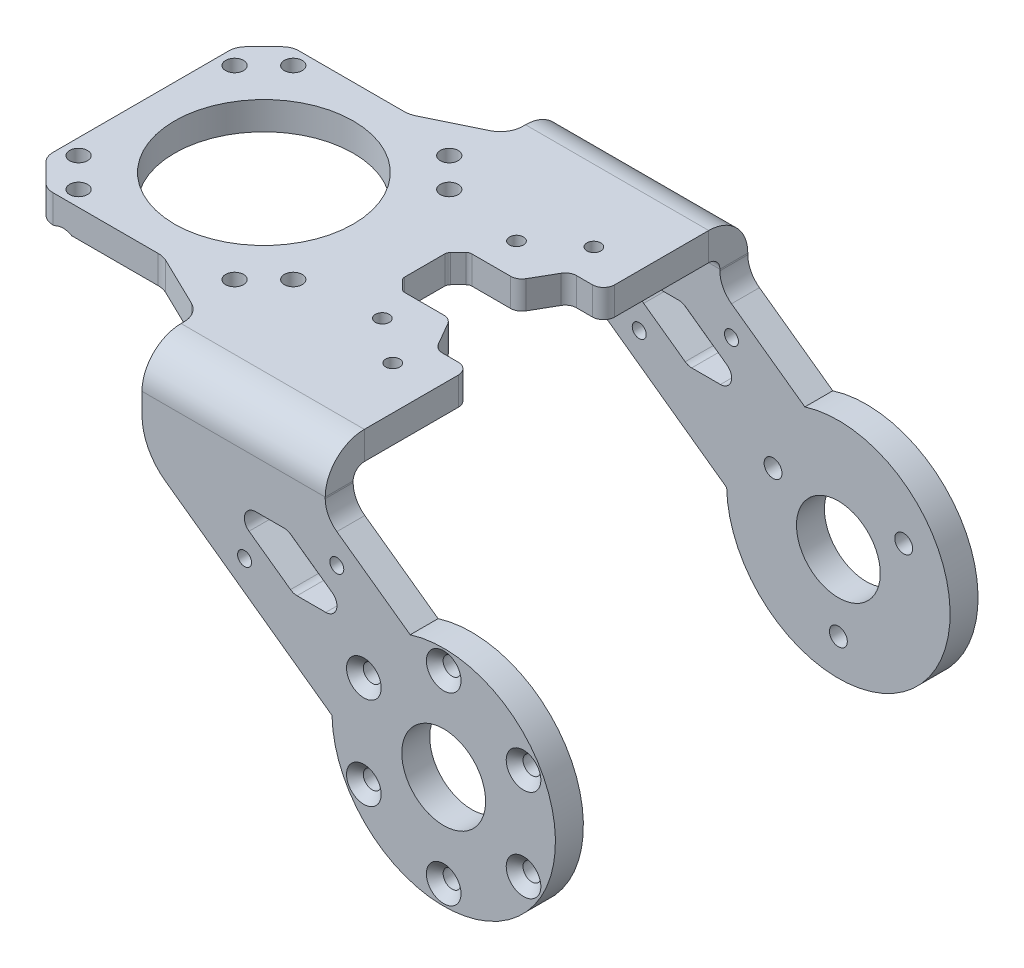
from build123d import *

# Parameters (mm, degrees)
SKETCH_1_R                     = 1.6
SKETCH_1_R_2                   = 16
SKETCH_1_R_3                   = 7.5
SM_BASE_FLANGE_1_DEPTH         = 5
OTHER_START                    = 37.819137438
OTHER_5_OUTLINE_W              = 32.792856849
OTHER_5_OUTLINE_H              = 5
OTHER_5_DEPTH                  = 38.830862462
OTHER_START_2                  = 32.819137438
OTHER_5_2_OUTLINE_R            = 1.6
OTHER_5_2_OUTLINE_R_2          = 7.5
OTHER_5_2_DEPTH                = 4.31918
OTHER_START_3                  = 30.819137438
OTHER_5_3_OUTLINE_R            = 1.6
OTHER_5_3_OUTLINE_R_2          = 7.5
OTHER_5_3_DEPTH                = 7
OTHER_START_4                  = 16
OTHER_5_4_DEPTH                = 75
OTHER_START_5                  = -77.5000001
OTHER_6_OUTLINE_W              = 32.792856849
OTHER_6_OUTLINE_H              = 5
OTHER_6_DEPTH                  = 39.680862662
OTHER_START_6                  = -37.138317438
OTHER_6_2_OUTLINE_R            = 1.6
OTHER_6_2_OUTLINE_R_2          = 7.5
OTHER_6_2_DEPTH                = 4.31918
OTHER_START_7                  = -37.819137438
OTHER_6_3_OUTLINE_R            = 1.6
OTHER_6_3_OUTLINE_R_2          = 7.5
OTHER_6_3_DEPTH                = 7
OTHER_6_4_DEPTH                = 75
CHAMFER_1_SIZE                 = 5
FILLET_1_R                     = 3
CUT_EXTRUDE_1_DEPTH            = 10
FILLET_3_R                     = 2
EXTRUDE_1_DEPTH                = 5
FILLET_5_R                     = 4
CHAMFER_3_SIZE                 = 2
FILLET_6_R                     = 1
SKETCH_16_R                    = 1
CUT_EXTRUDE_2_DEPTH            = 5
HOLE_WIZARD_M3_1_D             = 3.2
HOLE_WIZARD_M3_1_DEPTH         = 5
HOLE_WIZARD_M3_1_CSINK_D       = 6.4
HOLE_WIZARD_M3_1_CSINK_ANGLE   = 90
HOLE_WIZARD_M3_3_D             = 2.5
HOLE_WIZARD_M3_3_DEPTH         = 5
HOLE_WIZARD_M3_3_TIP           = 0.751075774
FILLET_9_R                     = 10
FILLET_10_R                    = 5
CUT_EXTRUDE_3_DEPTH            = 81
FILLET_11_R                    = 2
SKETCH_28_R                    = 1
CUT_EXTRUDE_4_DEPTH            = 81
HOLE_WIZARD_M3_1_2_D           = 3.2
HOLE_WIZARD_M3_1_2_DEPTH       = 10
HOLE_WIZARD_M3_1_2_CSINK_D     = 6.2
HOLE_WIZARD_M3_1_2_CSINK_ANGLE = 90
HOLE_WIZARD_M3_1_2_TIP         = 0.96137699
HOLE_WIZARD_M3_2_D             = 3.2
HOLE_WIZARD_M3_2_DEPTH         = 10
HOLE_WIZARD_M3_2_CSINK_D       = 6.2
HOLE_WIZARD_M3_2_CSINK_ANGLE   = 90
HOLE_WIZARD_M3_2_TIP           = 0.96137699
HOLE_WIZARD_M3_4_D             = 2.5


with BuildPart() as part:
    # 基体-法兰1: sheet metal written as solids
    # Sketch 1 → 基体-法兰1 (new body)
    with BuildSketch(Plane(origin=(0, 0, 0), x_dir=(1, 0, 0), z_dir=(0, 1, 0))):
        with BuildLine():
            Line((-22, 22), (-22, -22))
            Line((-22, -22), (16, -22))
            Line((16, -22), (16, -46))
            Line((16, -46), (50.004320143, -70.415676634))
            ThreePointArc((50.004320143, -70.415676634), (86.245949866, -81.664866607), (64.002160072, -50.920536795))
            Line((64.002160072, -50.920536795), (48.792856849, -40))
            Line((48.792856849, -40), (48.792856849, 40))
            Line((48.792856849, 40), (64.002160072, 50.920536795))
            ThreePointArc((64.002160072, 50.920536795), (86.245949866, 81.664866607), (50.004320143, 70.415676634))
            Line((50.004320143, 70.415676634), (16, 46))
            Line((16, 46), (16, 22))
            Line((16, 22), (-22, 22))
        make_face()
        with Locations(Location((-19.214153616, -13.959899742, 0), (0, 0, 270))):
            Circle(SKETCH_1_R, mode=Mode.SUBTRACT)
        with Locations(Location((-13.959899742, -19.214153616, 0), (0, 0, 270))):
            Circle(SKETCH_1_R, mode=Mode.SUBTRACT)
        with Locations(Location((-19.214153616, 13.959899742, 0), (0, 0, 90))):
            Circle(SKETCH_1_R, mode=Mode.SUBTRACT)
        with Locations(Location((-13.959899742, 19.214153616, 0), (0, 0, 90))):
            Circle(SKETCH_1_R, mode=Mode.SUBTRACT)
        with Locations(Location((13.959899742, -19.214153616, 0), (0, 0, 90))):
            Circle(SKETCH_1_R, mode=Mode.SUBTRACT)
        with Locations(Location((19.214153616, -13.959899742, 0), (0, 0, 90))):
            Circle(SKETCH_1_R, mode=Mode.SUBTRACT)
        with Locations(Location((19.214153616, 13.959899742, 0), (0, 0, 270))):
            Circle(SKETCH_1_R, mode=Mode.SUBTRACT)
        with Locations(Location((13.959899742, 19.214153616, 0), (0, 0, 270))):
            Circle(SKETCH_1_R, mode=Mode.SUBTRACT)
        with Locations(Location((0, 0, 0), (0, 0, 270))):
            Circle(SKETCH_1_R_2, mode=Mode.SUBTRACT)
        with Locations(Location((70, -53.5, 0), (0, 0, 270))):
            Circle(SKETCH_1_R, mode=Mode.SUBTRACT)
        with Locations(Location((84.289419162, -61.75, 0), (0, 0, 270))):
            Circle(SKETCH_1_R, mode=Mode.SUBTRACT)
        with Locations(Location((84.289419162, -78.25, 0), (0, 0, 270))):
            Circle(SKETCH_1_R, mode=Mode.SUBTRACT)
        with Locations(Location((70, -86.5, 0), (0, 0, 270))):
            Circle(SKETCH_1_R, mode=Mode.SUBTRACT)
        with Locations(Location((55.710580838, -78.25, 0), (0, 0, 270))):
            Circle(SKETCH_1_R, mode=Mode.SUBTRACT)
        with Locations(Location((55.710580838, -61.75, 0), (0, 0, 270))):
            Circle(SKETCH_1_R, mode=Mode.SUBTRACT)
        with Locations(Location((70, -70, 0), (0, 0, 270))):
            Circle(SKETCH_1_R_3, mode=Mode.SUBTRACT)
        with Locations(Location((70, 70, 0), (0, 0, 270))):
            Circle(SKETCH_1_R_3, mode=Mode.SUBTRACT)
        with Locations(Location((70, 83.5, 0), (0, 0, 270))):
            Circle(SKETCH_1_R, mode=Mode.SUBTRACT)
        with Locations(Location((81.691342951, 63.25, 0), (0, 0, 270))):
            Circle(SKETCH_1_R, mode=Mode.SUBTRACT)
        with Locations(Location((58.308657049, 63.25, 0), (0, 0, 270))):
            Circle(SKETCH_1_R, mode=Mode.SUBTRACT)
    extrude(amount=-SM_BASE_FLANGE_1_DEPTH)

    # Other 5: read off the stored shape, not the designer's step
    # Other 5 outline → Other 5 (cut)
    with BuildSketch(Plane.XY.offset(OTHER_START)):
        with Locations((32.396428425, -2.5)):
            Rectangle(OTHER_5_OUTLINE_W, OTHER_5_OUTLINE_H)
    extrude(amount=OTHER_5_DEPTH, mode=Mode.SUBTRACT)

    # Other 5 2 outline → Other 5 2 (add)
    with BuildSketch(Plane.XY.offset(OTHER_START_2)):
        with BuildLine():
            Line((64.002160072, -20.739674233), (48.792856849, -9.819137438))
            Line((48.792856849, -9.819137438), (48.792856849, -5))
            Line((48.792856849, -5), (16, -5))
            Line((16, -5), (16, -15.819137438))
            Line((16, -15.819137438), (50.004320143, -40.234814072))
            ThreePointArc((50.004320143, -40.234814072), (86.245949866, -51.484004046), (64.002160072, -20.739674233))
        make_face()
        with Locations((70, -56.319137438)):
            Circle(OTHER_5_2_OUTLINE_R, mode=Mode.SUBTRACT)
        with Locations((55.710580838, -48.069137438)):
            Circle(OTHER_5_2_OUTLINE_R, mode=Mode.SUBTRACT)
        with Locations((84.289419162, -48.069137438)):
            Circle(OTHER_5_2_OUTLINE_R, mode=Mode.SUBTRACT)
        with Locations((70, -39.819137438)):
            Circle(OTHER_5_2_OUTLINE_R_2, mode=Mode.SUBTRACT)
        with Locations((55.710580838, -31.569137438)):
            Circle(OTHER_5_2_OUTLINE_R, mode=Mode.SUBTRACT)
        with Locations((84.289419162, -31.569137438)):
            Circle(OTHER_5_2_OUTLINE_R, mode=Mode.SUBTRACT)
        with Locations((70, -23.319137438)):
            Circle(OTHER_5_2_OUTLINE_R, mode=Mode.SUBTRACT)
    extrude(amount=OTHER_5_2_DEPTH)

    # Other 5 3 outline → Other 5 3 (add)
    with BuildSketch(Plane.XY.offset(OTHER_START_3)):
        with BuildLine():
            Line((64.002160072, -20.739674233), (48.792856849, -9.819137438))
            Line((48.792856849, -9.819137438), (48.792856849, -5))
            Line((48.792856849, -5), (16, -5))
            Line((16, -5), (16, -15.819137438))
            Line((16, -15.819137438), (50.004320143, -40.234814072))
            ThreePointArc((50.004320143, -40.234814072), (86.245949866, -51.484004046), (64.002160072, -20.739674233))
        make_face()
        with Locations((70, -56.319137438)):
            Circle(OTHER_5_3_OUTLINE_R, mode=Mode.SUBTRACT)
        with Locations((55.710580838, -48.069137438)):
            Circle(OTHER_5_3_OUTLINE_R, mode=Mode.SUBTRACT)
        with Locations((84.289419162, -48.069137438)):
            Circle(OTHER_5_3_OUTLINE_R, mode=Mode.SUBTRACT)
        with Locations((70, -39.819137438)):
            Circle(OTHER_5_3_OUTLINE_R_2, mode=Mode.SUBTRACT)
        with Locations((55.710580838, -31.569137438)):
            Circle(OTHER_5_3_OUTLINE_R, mode=Mode.SUBTRACT)
        with Locations((84.289419162, -31.569137438)):
            Circle(OTHER_5_3_OUTLINE_R, mode=Mode.SUBTRACT)
        with Locations((70, -23.319137438)):
            Circle(OTHER_5_3_OUTLINE_R, mode=Mode.SUBTRACT)
    extrude(amount=OTHER_5_3_DEPTH)

    # Other 5 4 outline → Other 5 4 (cut)
    with BuildSketch(Plane.YZ.offset(OTHER_START_4)):
        with BuildLine():
            Line((-7, 32.819137438), (-61, 32.819137438))
            Line((-61, 32.819137438), (-61, 30.819137438))
            Line((-61, 30.819137438), (-5, 30.819137438))
            ThreePointArc((-5, 30.819137438), (-5.585786437, 32.233351001), (-7, 32.819137438))
        make_face()
        with BuildLine():
            Line((0, 30.819137438), (0, 91))
            Line((0, 91), (-5, 91))
            Line((-5, 91), (-5, 37.819137438))
            Line((-5, 37.819137438), (-7, 37.819137438))
            ThreePointArc((-7, 37.819137438), (-2.050252531, 35.768884906), (0, 30.819137438))
        make_face()
    extrude(amount=OTHER_5_4_DEPTH, mode=Mode.SUBTRACT)

    # Other 6: read off the stored shape, not the designer's step
    # Other 6 outline → Other 6 (cut)
    with BuildSketch(Plane.XY.offset(OTHER_START_5)):
        with Locations((32.396428425, -2.5)):
            Rectangle(OTHER_6_OUTLINE_W, OTHER_6_OUTLINE_H)
    extrude(amount=OTHER_6_DEPTH, mode=Mode.SUBTRACT)

    # Other 6 2 outline → Other 6 2 (add)
    with BuildSketch(Plane.XY.offset(OTHER_START_6)):
        with BuildLine():
            Line((48.792856849, -9.819137438), (48.792856849, -5))
            Line((48.792856849, -5), (16, -5))
            Line((16, -5), (16, -15.819137438))
            Line((16, -15.819137438), (50.004320143, -40.234814072))
            ThreePointArc((50.004320143, -40.234814072), (86.245949866, -51.484004046), (64.002160072, -20.739674233))
            Line((64.002160072, -20.739674233), (48.792856849, -9.819137438))
        make_face()
        with Locations((70, -53.319137438)):
            Circle(OTHER_6_2_OUTLINE_R, mode=Mode.SUBTRACT)
        with Locations((70, -39.819137438)):
            Circle(OTHER_6_2_OUTLINE_R_2, mode=Mode.SUBTRACT)
        with Locations((58.308657049, -33.069137438)):
            Circle(OTHER_6_2_OUTLINE_R, mode=Mode.SUBTRACT)
        with Locations((81.691342951, -33.069137438)):
            Circle(OTHER_6_2_OUTLINE_R, mode=Mode.SUBTRACT)
    extrude(amount=OTHER_6_2_DEPTH)

    # Other 6 3 outline → Other 6 3 (add)
    with BuildSketch(Plane.XY.offset(OTHER_START_7)):
        with BuildLine():
            Line((64.002160072, -20.739674233), (48.792856849, -9.819137438))
            Line((48.792856849, -9.819137438), (48.792856849, -5))
            Line((48.792856849, -5), (16, -5))
            Line((16, -5), (16, -15.819137438))
            Line((16, -15.819137438), (50.004320143, -40.234814072))
            ThreePointArc((50.004320143, -40.234814072), (86.245949866, -51.484004046), (64.002160072, -20.739674233))
        make_face()
        with Locations((70, -53.319137438)):
            Circle(OTHER_6_3_OUTLINE_R, mode=Mode.SUBTRACT)
        with Locations((70, -39.819137438)):
            Circle(OTHER_6_3_OUTLINE_R_2, mode=Mode.SUBTRACT)
        with Locations((58.308657049, -33.069137438)):
            Circle(OTHER_6_3_OUTLINE_R, mode=Mode.SUBTRACT)
        with Locations((81.691342951, -33.069137438)):
            Circle(OTHER_6_3_OUTLINE_R, mode=Mode.SUBTRACT)
    extrude(amount=OTHER_6_3_DEPTH)

    # Other 6 4 outline → Other 6 4 (cut)
    with BuildSketch(Plane.YZ.offset(OTHER_START_4)):
        with BuildLine():
            Line((-61, -32.819137438), (-7, -32.819137438))
            ThreePointArc((-7, -32.819137438), (-5.585786437, -32.233351001), (-5, -30.819137438))
            Line((-5, -30.819137438), (-61, -30.819137438))
            Line((-61, -30.819137438), (-61, -32.819137438))
        make_face()
        with BuildLine():
            Line((-7, -37.819137438), (-5, -37.819137438))
            Line((-5, -37.819137438), (-5, -92))
            Line((-5, -92), (0, -92))
            Line((0, -92), (0, -30.819137438))
            ThreePointArc((0, -30.819137438), (-2.050252531, -35.768884906), (-7, -37.819137438))
        make_face()
    extrude(amount=OTHER_6_4_DEPTH, mode=Mode.SUBTRACT)

    # 倒角1
    chamfer_1_edges = [part.edges().sort_by_distance(p)[0] for p in [
        (-22, -2.5, -22),
        (-22, -2.5, 22),
    ]]
    chamfer(chamfer_1_edges, length=CHAMFER_1_SIZE)

    # 圆角1
    fillet_1_edges = [part.edges().sort_by_distance(p)[0] for p in [
        (-17, -2.5, -22),
        (-22, -2.5, 17),
        (-22, -2.5, -17),
        (-17, -2.5, 22),
    ]]
    fillet(fillet_1_edges, radius=FILLET_1_R)

    # 草图14 → 切除-拉伸1 (cut)
    with BuildSketch(Plane(origin=(0, 0, 0), x_dir=(1, 0, 0), z_dir=(0, 1, 0))):
        Polygon((48.792856849, -12), (42.792856849, -12), (39.328755234, -6), (28.792856849, -6), (28.792856849, 6), (39.328755234, 6), (42.792856849, 12), (48.792856849, 12), align=None)
    extrude(amount=-CUT_EXTRUDE_1_DEPTH, mode=Mode.SUBTRACT)

    # 圆角3
    fillet_3_edges = [part.edges().sort_by_distance(p)[0] for p in [
        (48.792856849, -2.5, -12),
        (48.792856849, -2.5, 12),
        (42.792856849, -2.5, 12),
        (39.328755234, -2.5, 6),
        (39.328755234, -2.5, -6),
        (42.792856849, -2.5, -12),
    ]]
    fillet(fillet_3_edges, radius=FILLET_3_R)

    # 草图15 → 凸台-拉伸1 (add)
    with BuildSketch(Plane(origin=(0, 0, 0), x_dir=(1, 0, 0), z_dir=(0, 1, 0))):
        Polygon((16, 27.819137438), (16, 22), (4, 22), align=None)
        Polygon((4, -22), (16, -27.819137438), (16, -22), align=None)
    extrude(amount=-EXTRUDE_1_DEPTH)

    # 圆角5
    fillet_5_edges = [part.edges().sort_by_distance(p)[0] for p in [
        (4, -2.5, -22),
        (16, -2.5, -27.819137438),
        (4, -2.5, 22),
        (16, -2.5, 27.819137438),
    ]]
    fillet(fillet_5_edges, radius=FILLET_5_R)

    # 倒角3
    chamfer_3_edges = [part.edges().sort_by_distance(p)[0] for p in [
        (28.792856849, -2.5, 6),
        (28.792856849, -2.5, -6),
    ]]
    chamfer(chamfer_3_edges, length=CHAMFER_3_SIZE)

    # 圆角6
    fillet_6_edges = [part.edges().sort_by_distance(p)[0] for p in [
        (30.792856849, -2.5, 6),
        (28.792856849, -2.5, -4),
        (28.792856849, -2.5, 4),
        (30.792856849, -2.5, -6),
    ]]
    fillet(fillet_6_edges, radius=FILLET_6_R)

    # 草图16 → 切除-拉伸2 (cut)
    with BuildSketch(Plane(origin=(0, 0, 0), x_dir=(1, 0, 0), z_dir=(0, 1, 0))):
        with Locations(Location((33.207070411, 12, 0), (0, 0, 270))):
            Circle(SKETCH_16_R)
        with Locations(Location((41.060806041, 18, 0), (0, 0, 270))):
            Circle(SKETCH_16_R)
        with Locations(Location((33.207070411, -12, 0), (0, 0, 90))):
            Circle(SKETCH_16_R)
        with Locations(Location((41.060806041, -18, 0), (0, 0, 90))):
            Circle(SKETCH_16_R)
    extrude(amount=-CUT_EXTRUDE_2_DEPTH, mode=Mode.SUBTRACT)

    # Hole Wizard M3 _1
    with Locations(Plane.XZ.offset(5)):
        with Locations((-13.959899742, 19.214153616), (-19.214153616, 13.959899742), (-19.214153616, -13.959899742), (-13.959899742, -19.214153616), (13.959899742, -19.214153616), (19.214153616, -13.959899742), (19.214153616, 13.959899742), (13.959899742, 19.214153616)):
            CounterSinkHole(HOLE_WIZARD_M3_1_D / 2, HOLE_WIZARD_M3_1_CSINK_D / 2, depth=HOLE_WIZARD_M3_1_DEPTH, counter_sink_angle=HOLE_WIZARD_M3_1_CSINK_ANGLE)

    # M3 螺纹孔3
    with Locations(Plane(origin=(0, 0, 0), x_dir=(1, 0, 0), z_dir=(0, 1, 0))):
        with Locations((33.207070411, -12), (41.060806041, -18), (33.207070411, 12), (41.060806041, 18)):
            Hole(HOLE_WIZARD_M3_3_D / 2, depth=HOLE_WIZARD_M3_3_DEPTH)
            with Locations((0, 0, -(HOLE_WIZARD_M3_3_DEPTH + HOLE_WIZARD_M3_3_TIP / 2))):  # 118° drill point
                Cone(0, HOLE_WIZARD_M3_3_D / 2, HOLE_WIZARD_M3_3_TIP, mode=Mode.SUBTRACT)

    # 圆角9
    fillet_9_edges = [part.edges().sort_by_distance(p)[0] for p in [
        (16, -15.819137438, 35.319137438),
        (16, -15.819137438, -35.319137438),
    ]]
    fillet(fillet_9_edges, radius=FILLET_9_R)

    # 圆角10
    fillet_10_edges = [part.edges().sort_by_distance(p)[0] for p in [
        (48.792856849, -9.819137438, 35.319137438),
        (48.792856849, -9.819137438, -35.319137438),
    ]]
    fillet(fillet_10_edges, radius=FILLET_10_R)

    # 草图26 → 切除-拉伸3 (cut)
    with BuildSketch(Plane.XY.offset(37.819137438)):
        Polygon((30.11236701, -15.487244153), (42.11236701, -15.487244153), (55.109126902, -24.819137438), (43.109126902, -24.819137438), align=None)
    extrude(amount=-CUT_EXTRUDE_3_DEPTH, mode=Mode.SUBTRACT)

    # 圆角11
    fillet_11_edges = [part.edges().sort_by_distance(p)[0] for p in [
        (43.109126902, -24.819137438, 35.319137438),
        (43.109126902, -24.819137438, -35.319137438),
        (30.11236701, -15.487244153, 35.319137438),
        (30.11236701, -15.487244153, -35.319137438),
        (42.11236701, -15.487244153, 35.319137438),
        (42.11236701, -15.487244153, -35.319137438),
        (55.109126902, -24.819137438, 35.319137438),
        (55.109126902, -24.819137438, -35.319137438),
    ]]
    fillet(fillet_11_edges, radius=FILLET_11_R)

    # 草图28 → 切除-拉伸4 (cut)
    with BuildSketch(Plane.XY.offset(37.819137438)):
        with Locations(Location((50.864664532, -16.565316125, 0), (0, 0, 270))):
            Circle(SKETCH_28_R)
        with Locations(Location((34.35682938, -23.741065466, 0), (0, 0, 270))):
            Circle(SKETCH_28_R)
    extrude(amount=-CUT_EXTRUDE_4_DEPTH, mode=Mode.SUBTRACT)

    # Hole Wizard M3 _1 2
    with Locations(Plane(origin=(55.710580838, -31.569137438, 37.819137438), x_dir=(0, 1, 0), z_dir=(0, 0, 1))):
        with Locations((0, 0), (-16.5, 0), (-24.75, -14.289419162), (-16.5, -28.578838324), (0, -28.578838324), (8.25, -14.289419162)):
            CounterSinkHole(HOLE_WIZARD_M3_1_2_D / 2, HOLE_WIZARD_M3_1_2_CSINK_D / 2, depth=HOLE_WIZARD_M3_1_2_DEPTH, counter_sink_angle=HOLE_WIZARD_M3_1_2_CSINK_ANGLE)
            with Locations((0, 0, -(HOLE_WIZARD_M3_1_2_DEPTH + HOLE_WIZARD_M3_1_2_TIP / 2))):  # 118° drill point
                Cone(0, HOLE_WIZARD_M3_1_2_D / 2, HOLE_WIZARD_M3_1_2_TIP, mode=Mode.SUBTRACT)

    # M3 十字槽半沉头木螺钉的锥形沉头孔2
    with Locations(Plane(origin=(0, 0, -37.819137438), x_dir=(-1, 0, 0), z_dir=(0, 0, -1))):
        with Locations((-81.691342951, -33.069137438), (-58.308657049, -33.069137438), (-70, -53.319137438)):
            CounterSinkHole(HOLE_WIZARD_M3_2_D / 2, HOLE_WIZARD_M3_2_CSINK_D / 2, depth=HOLE_WIZARD_M3_2_DEPTH, counter_sink_angle=HOLE_WIZARD_M3_2_CSINK_ANGLE)
            with Locations((0, 0, -(HOLE_WIZARD_M3_2_DEPTH + HOLE_WIZARD_M3_2_TIP / 2))):  # 118° drill point
                Cone(0, HOLE_WIZARD_M3_2_D / 2, HOLE_WIZARD_M3_2_TIP, mode=Mode.SUBTRACT)

    # M3 螺纹孔4 (through all)
    with Locations(Plane(origin=(0, 0, -37.819137438), x_dir=(-1, 0, 0), z_dir=(0, 0, -1))):
        with Locations((-50.864664532, -16.565316125), (-34.35682938, -23.741065466)):
            Hole(HOLE_WIZARD_M3_4_D / 2)


solid = part.part
